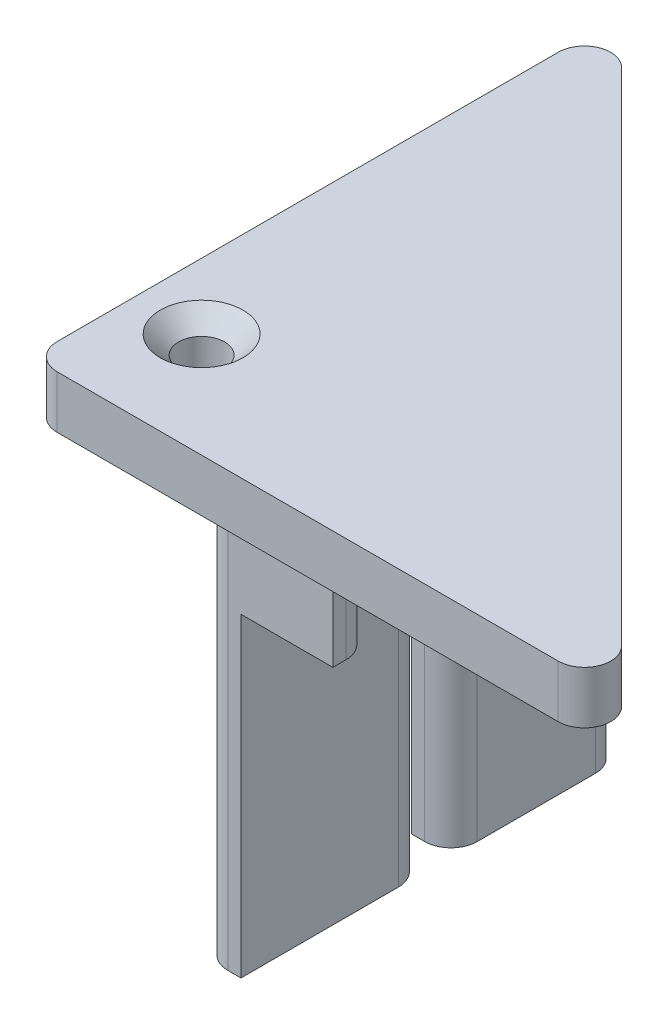
from build123d import *

# Parameters (mm, degrees)
SKETCH1_R                                           = 1.75
BOSS_EXTRUDE1_DEPTH                                 = 4
CSK_FOR_M3_COUNTERSUNK_FLAT_HEAD_SCREW1_D           = 3.2
CSK_FOR_M3_COUNTERSUNK_FLAT_HEAD_SCREW1_CSINK_D     = 6.3
CSK_FOR_M3_COUNTERSUNK_FLAT_HEAD_SCREW1_CSINK_ANGLE = 90
FILLET1_R                                           = 2
SKETCH5_W                                           = 3
SKETCH5_H                                           = 14
SKETCH5_H_2                                         = 13
BOSS_EXTRUDE2_DEPTH                                 = 32
SKETCH6_W                                           = 7
SKETCH6_H                                           = 3
BOSS_EXTRUDE3_DEPTH                                 = 8
FILLET2_R                                           = 2


with BuildPart() as part:
    # Sketch1 → Boss-Extrude1 (new body)
    with BuildSketch(Plane(origin=(0, 0, 0), x_dir=(1, 0, 0), z_dir=(0, 1, 0))):
        Polygon((-22.811288741, 22.811288741), (22.188711259, -22.188711259), (-22.811288741, -22.188711259), align=None)
        with Locations((-17.811288741, -14.188711259)):
            Circle(SKETCH1_R, mode=Mode.SUBTRACT)
    extrude(amount=BOSS_EXTRUDE1_DEPTH)

    # CSK for M3 Countersunk Flat Head Screw1 (through all)
    with Locations(Plane(origin=(0, 4, 0), x_dir=(1, 0, 0), z_dir=(0, 1, 0))):
        with Locations((-17.811288741, -14.188711259)):
            CounterSinkHole(CSK_FOR_M3_COUNTERSUNK_FLAT_HEAD_SCREW1_D / 2, CSK_FOR_M3_COUNTERSUNK_FLAT_HEAD_SCREW1_CSINK_D / 2, counter_sink_angle=CSK_FOR_M3_COUNTERSUNK_FLAT_HEAD_SCREW1_CSINK_ANGLE)

    # Fillet1
    fillet1_edges = [part.edges().sort_by_distance(p)[0] for p in [
        (-22.811288741, 2, 22.188711259),
        (22.188711259, 2, 22.188711259),
        (-22.811288741, 2, -22.811288741),
    ]]
    fillet(fillet1_edges, radius=FILLET1_R)

    # Sketch5 → Boss-Extrude2 (add)
    with BuildSketch(Plane.XZ):
        with Locations((-11.311288741, 12.188711259)):
            Rectangle(SKETCH5_W, SKETCH5_H)
        with Locations((-11.311288741, -3.311288741)):
            Rectangle(SKETCH5_W, SKETCH5_H_2)
    extrude(amount=BOSS_EXTRUDE2_DEPTH)

    # Sketch6 → Boss-Extrude3 (add)
    with BuildSketch(Plane.XZ):
        with Locations((-6.311288741, 17.688711259)):
            Rectangle(SKETCH6_W, SKETCH6_H)
    extrude(amount=BOSS_EXTRUDE3_DEPTH)

    # Fillet2
    fillet2_edges = [part.edges().sort_by_distance(p)[0] for p in [
        (-12.811288741, -16, 19.188711259),
        (-9.811288741, -16, -9.811288741),
        (-2.811288741, -4, 16.188711259),
        (-9.811288741, -16, 3.188711259),
        (-9.811288741, -16, 5.188711259),
    ]]
    fillet(fillet2_edges, radius=FILLET2_R)


solid = part.part
